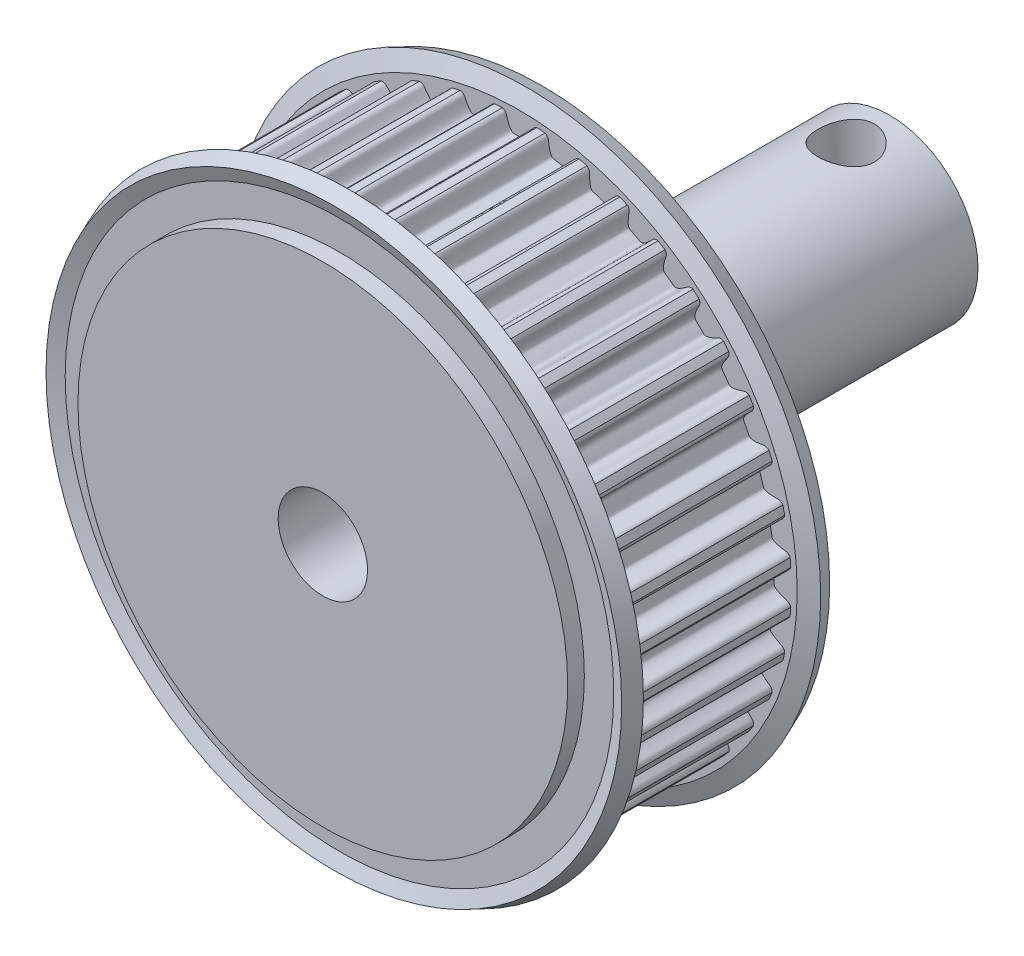
from build123d import *

# Parameters (mm, degrees)
TOOTHEXTRUDECUTGEARBELT01_DEPTH = 3.749999944
TOOTH_PATTERN_40_COUNT          = 40
BOREREVOLVESKETCH_W             = 10.547999842
BOREREVOLVESKETCH_H             = 5
SKETCH_5_R                      = 5.546509326
EXTRUDE_1_DEPTH                 = 11
SKETCH_6_R                      = 4.05
SKETCH_6_R_2                    = 2.05
EXTRUDE_3_DEPTH                 = 15
CUT_EXTRUDE_START               = -785
SKETCH_7_R                      = 2.05
CUT_EXTRUDE_4_DEPTH             = 785
EXTRUDE_START                   = -11
EXTRUDE_4_DEPTH                 = 11
SKETCH_9_R                      = 1.3
CUT_EXTRUDE_5_DEPTH             = 11


with BuildPart() as part:
    # SketchRevolveGearBelt01 → Gates_PowerGrip_GT_2mm, 6mm Belt Width (revolve)
    with BuildSketch(Plane(origin=(0, 0, 0), x_dir=(0, 0, -1), z_dir=(1, 0, 0)), mode=Mode.PRIVATE) as gates_powergrip_gt_2mm_6mm_belt_width_sk:
        Polygon((5.273999921, 0), (5.273999921, 11.232395279), (4.511999932, 11.232395279), (4.511999932, 12.580824034), (4.769626867, 13.202790474), (4.065630673, 13.494395245), (3.749999944, 12.732395256), (3.749999944, 12.46357944), (-3.749999944, 12.46357944), (-3.749999944, 12.732395256), (-4.065630673, 13.494395245), (-4.769626867, 13.202790474), (-4.511999932, 12.580824034), (-4.511999932, 11.232395279), (-5.273999921, 11.232395279), (-5.273999921, 0), align=None)
    revolve(gates_powergrip_gt_2mm_6mm_belt_width_sk.sketch.rotate(Axis((0, 0, 0), (0, 0, -1)), 90), axis=Axis((0, 0, 0), (0, 0, -1)))

    # SketchToothGearBelt01 → ToothExtrudeCutGearBelt01 (cut, symmetric)
    with BuildSketch(Plane.XY):
        with BuildLine():
            ThreePointArc((12.448081962, 0.861658269), (12.477868388, 0), (12.448081962, -0.861658269))
            add(Edge.make_bspline(
                [(12.448081962, -0.861658269), (12.44814702, -0.844334276), (12.445695517, -0.81834059), (12.437448736, -0.784646245), (12.428834635, -0.76009708), (12.417872883, -0.736502489), (12.404667606, -0.714086272), (12.389343998, -0.693061347), (12.372047733, -0.673626365), (12.352941906, -0.65596886), (12.332211579, -0.640244684), (12.310039342, -0.626646652), (12.286688204, -0.615140987), (12.247627049, -0.601278558), (12.197669543, -0.58617458), (12.138567847, -0.567480542), (12.086118353, -0.549825827), (12.036838798, -0.532186864), (11.990734623, -0.514546576), (11.947803409, -0.496909287), (11.908044361, -0.479273964), (11.871455882, -0.461640694), (11.838036062, -0.444008949), (11.807782407, -0.426377751), (11.780691891, -0.408745201), (11.756760686, -0.391107907), (11.735985493, -0.373460068), (11.718361421, -0.355792311), (11.703894927, -0.33809054), (11.692574161, -0.320336691), (11.684488288, -0.302512788), (11.679447526, -0.28461649), (11.677246281, -0.250312541), (11.680428548, -0.199994192), (11.680572602, -0.1333067), (11.681341135, -0.066656855), (11.681455207, 0), (11.681341135, 0.066656855), (11.680572602, 0.1333067), (11.680428548, 0.199994192), (11.677246281, 0.250312541), (11.679447526, 0.28461649), (11.684488288, 0.302512788), (11.692574161, 0.320336691), (11.703894927, 0.33809054), (11.718361421, 0.355792311), (11.735985493, 0.373460068), (11.756760686, 0.391107907), (11.780691891, 0.408745201), (11.807782407, 0.426377751), (11.838036062, 0.444008949), (11.871455882, 0.461640694), (11.908044361, 0.479273964), (11.947803409, 0.496909287), (11.990734623, 0.514546576), (12.036838798, 0.532186864), (12.086118353, 0.549825827), (12.138567847, 0.567480542), (12.197669543, 0.58617458), (12.247627049, 0.601278558), (12.286688204, 0.615140987), (12.310039342, 0.626646652), (12.332211579, 0.640244684), (12.352941906, 0.65596886), (12.372047733, 0.673626365), (12.389343998, 0.693061347), (12.404667606, 0.714086272), (12.417872883, 0.736502489), (12.428834635, 0.76009708), (12.437448736, 0.784646245), (12.445695517, 0.81834059), (12.44814702, 0.844334276), (12.448081962, 0.861658269)],
                knots=[0, 0, 0, 0, 0.019855995, 0.029783993, 0.03971199, 0.049639988, 0.059567985, 0.069495983, 0.07942398, 0.089351978, 0.099279975, 0.109207973, 0.11913597, 0.129063968, 0.156684055, 0.178986737, 0.200134998, 0.220135968, 0.238998082, 0.256731398, 0.273348024, 0.288862686, 0.303293478, 0.3166629, 0.328999259, 0.340338602, 0.35072736, 0.360225913, 0.368913222, 0.376892371, 0.38429608, 0.39128991, 0.398069514, 0.423571008, 0.449047338, 0.474523669, 0.5, 0.525476331, 0.550952662, 0.576428992, 0.601930486, 0.60871009, 0.61570392, 0.623107629, 0.631086778, 0.639774087, 0.64927264, 0.659661398, 0.671000741, 0.6833371, 0.696706522, 0.711137314, 0.726651976, 0.743268602, 0.761001918, 0.779864032, 0.799865002, 0.821013263, 0.843315945, 0.870936032, 0.88086403, 0.890792027, 0.900720025, 0.910648022, 0.92057602, 0.930504017, 0.940432015, 0.950360012, 0.96028801, 0.970216007, 0.980144005, 1, 1, 1, 1], degree=3))
        make_face()
    toothextrudecutgearbelt01 = extrude(amount=TOOTHEXTRUDECUTGEARBELT01_DEPTH, both=True, mode=Mode.SUBTRACT)

    # Tooth Pattern, 40: ToothExtrudeCutGearBelt01 ×40 about axis
    tooth_pattern_40_axis = Axis((0, 0, 55), (0, 0, -1))
    for i in range(1, TOOTH_PATTERN_40_COUNT):
        add(toothextrudecutgearbelt01.rotate(tooth_pattern_40_axis, i * 360 / TOOTH_PATTERN_40_COUNT), mode=Mode.SUBTRACT)

    # BoreRevolveSketch → BoreRevolveCut (revolve, cut)
    with BuildSketch(Plane(origin=(0, 0, 0), x_dir=(0, 0, -1), z_dir=(1, 0, 0)), mode=Mode.PRIVATE) as borerevolvecut_sk:
        with Locations((0, 2.5)):
            Rectangle(BOREREVOLVESKETCH_W, BOREREVOLVESKETCH_H)
    revolve(borerevolvecut_sk.sketch.rotate(Axis((0, 0, 0), (0, 0, -1)), 90), axis=Axis((0, 0, 0), (0, 0, -1)), mode=Mode.SUBTRACT)

    # 草图5 → 凸台-拉伸1 (add)
    with BuildSketch(Plane.XY.offset(5.273999921)):
        Circle(SKETCH_5_R)
    extrude(amount=-EXTRUDE_1_DEPTH)

    # 草图6 → 凸台-拉伸3 (add)
    with BuildSketch(Plane(origin=(0, 0, -5.726000079), x_dir=(-1, 0, 0), z_dir=(0, 0, -1))):
        with Locations(Location((0, 0, 0), (0, 0, 180))):
            Circle(SKETCH_6_R)
        Circle(SKETCH_6_R_2, mode=Mode.SUBTRACT)
    extrude(amount=EXTRUDE_3_DEPTH)

    # 草图7 → 切除-拉伸4 (cut)
    with BuildSketch(Plane(origin=(0, 0, -5.726000079), x_dir=(-1, 0, 0), z_dir=(0, 0, -1)).offset(CUT_EXTRUDE_START)):
        Circle(SKETCH_7_R)
    extrude(amount=CUT_EXTRUDE_4_DEPTH, mode=Mode.SUBTRACT)

    # 草图8 → 凸台-拉伸4 (add)
    with BuildSketch(Plane(origin=(0, 0, -20.726000079), x_dir=(-1, 0, 0), z_dir=(0, 0, -1)).offset(EXTRUDE_START)):
        with BuildLine():
            ThreePointArc((1.397318861, 1.5), (0, 2.05), (-1.397318861, 1.5))
            Line((-1.397318861, 1.5), (0, 1.5))
            Line((0, 1.5), (1.397318861, 1.5))
        make_face()
    extrude(amount=EXTRUDE_4_DEPTH)

    # 草图9 → 切除-拉伸5 (cut)
    with BuildSketch(Plane.XZ.offset(-1.5)):
        with Locations(Location((0, -18.726000079, 0), (0, 0, 270))):
            Circle(SKETCH_9_R)
    extrude(amount=-CUT_EXTRUDE_5_DEPTH, mode=Mode.SUBTRACT)


solid = part.part
